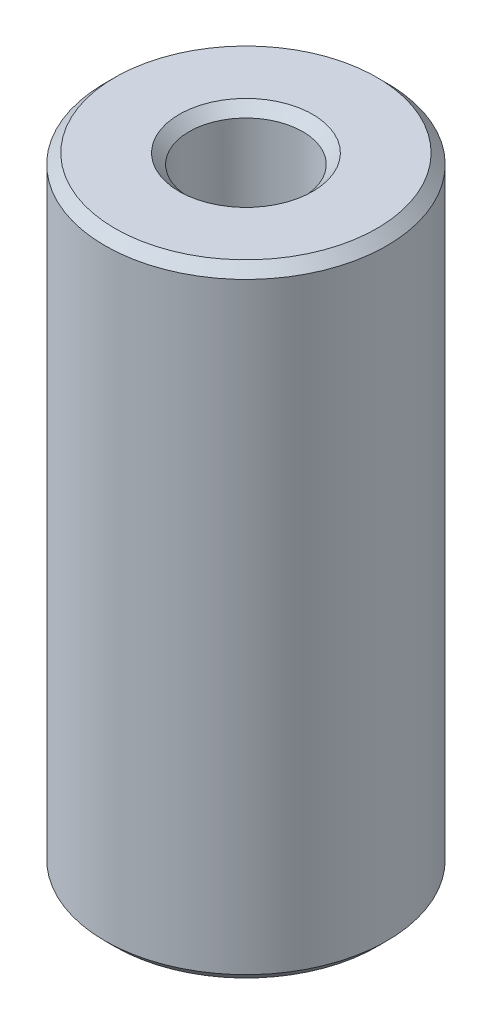
from build123d import *

# Parameters (mm, degrees)
SKETCH1_R           = 22.5
BOSS_EXTRUDE1_DEPTH = 99.328308604
SKETCH2_R           = 9.074357372
CUT_EXTRUDE1_DEPTH  = 105.300589117
CHAMFER1_SIZE       = 1.590208513


with BuildPart() as part:
    # Sketch1 → Boss-Extrude1 (new body)
    with BuildSketch(Plane(origin=(0, 0, 0), x_dir=(1, 0, 0), z_dir=(0, 1, 0))):
        Circle(SKETCH1_R)
    extrude(amount=BOSS_EXTRUDE1_DEPTH)

    # Sketch2 → Cut-Extrude1 (cut, through all)
    with BuildSketch(Plane(origin=(0, 0, 0), x_dir=(1, 0, 0), z_dir=(0, 1, 0))):
        Circle(SKETCH2_R)
    extrude(amount=CUT_EXTRUDE1_DEPTH, mode=Mode.SUBTRACT)

    # Chamfer1
    chamfer1_edges = [part.edges().sort_by_distance(p)[0] for p in [
        (-9.074357372, 99.328308604, 0),
        (-9.074357372, 0, 0),
        (-22.5, 0, 0),
        (-22.5, 99.328308604, 0),
    ]]
    chamfer(chamfer1_edges, length=CHAMFER1_SIZE)


solid = part.part
